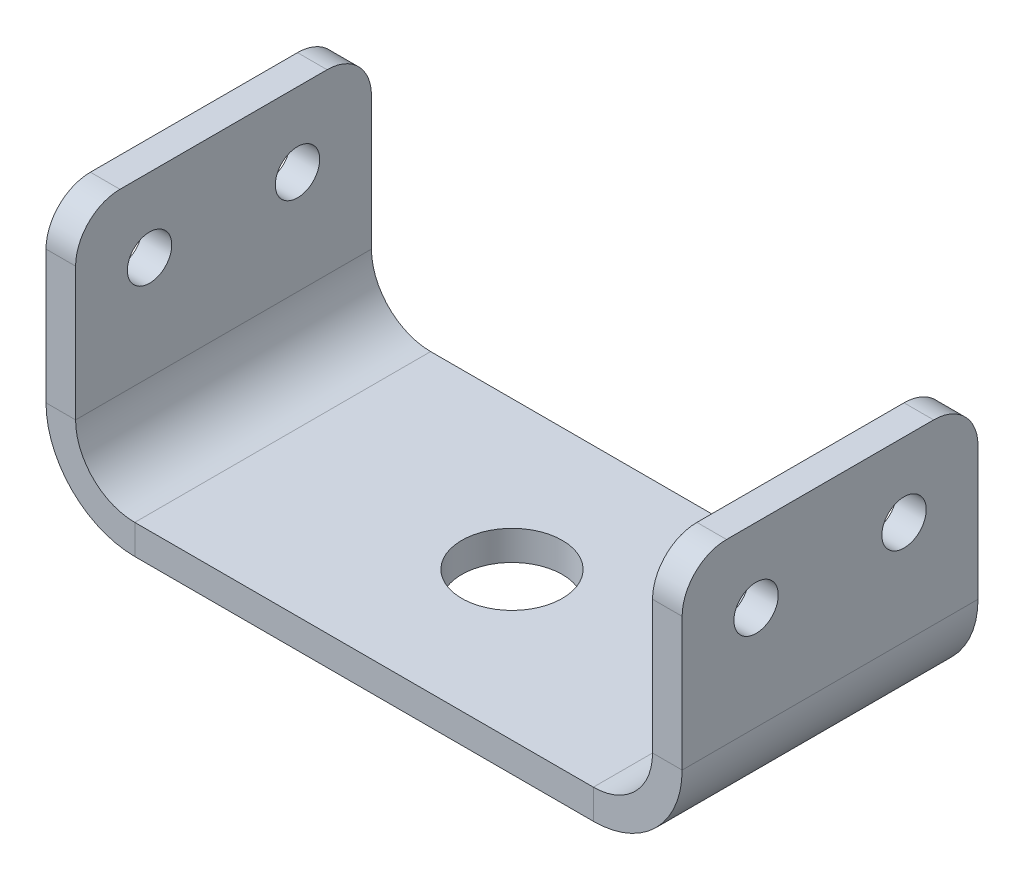
from build123d import *

# Parameters (mm, degrees)
SKETCH1_W            = 20
SKETCH1_H            = 6
BOSS_EXTRUDE1_DEPTH  = 21.5
SKETCH2_W            = 6
SKETCH2_H            = 20
BOSS_EXTRUDE2_DEPTH  = 12
SKETCH7_R            = 1.5
CUT_EXTRUDE1_DEPTH   = 46.749316935
SKETCH8_R            = 3.4
CUT_EXTRUDE2_DEPTH   = 30.769951293
FILLET2_R            = 3
CONVERT_SOLID2_START = -10
CONVERT_SOLID2_DEPTH = 20


# Read off the part's stored shape, not the designer's step: Convert-Solid2
with BuildPart() as part:
    # Sketch1 → Boss-Extrude1 (new, symmetric)
    with BuildSketch(Plane(origin=(0, 0, 0), x_dir=(0, 0, -1), z_dir=(1, 0, 0))):
        with Locations((0, -3)):
            Rectangle(SKETCH1_W, SKETCH1_H)
    extrude(amount=BOSS_EXTRUDE1_DEPTH, both=True)

    # Sketch2 → Boss-Extrude2 (add)
    with BuildSketch(Plane(origin=(0, 0, 0), x_dir=(1, 0, 0), z_dir=(0, 1, 0))):
        with Locations((18.5, 0)):
            Rectangle(SKETCH2_W, SKETCH2_H)
        with Locations((-18.5, 0)):
            Rectangle(SKETCH2_W, SKETCH2_H)
    extrude(amount=BOSS_EXTRUDE2_DEPTH)

    # Sketch7 → Cut-Extrude1 (cut, through all)
    with BuildSketch(Plane.ZY.offset(21.5)):
        with Locations((-5, 7)):
            Circle(SKETCH7_R)
        with Locations((5, 7)):
            Circle(SKETCH7_R)
    extrude(amount=-CUT_EXTRUDE1_DEPTH, mode=Mode.SUBTRACT)

    # Sketch8 → Cut-Extrude2 (cut, through all)
    with BuildSketch(Plane.XZ.offset(6)):
        with Locations(Location((0, 0, 0), (0, 0, 270))):
            Circle(SKETCH8_R)
    extrude(amount=-CUT_EXTRUDE2_DEPTH, mode=Mode.SUBTRACT)

    # Fillet2
    fillet2_edges = [part.edges().sort_by_distance(p)[0] for p in [
        (-18.5, 12, 10),
        (-18.5, 12, -10),
        (18.5, 12, -10),
        (18.5, 12, 10),
    ]]
    fillet(fillet2_edges, radius=FILLET2_R)

    # Convert-Solid2 outline → Convert-Solid2 (cut)
    with BuildSketch(Plane.XY.offset(CONVERT_SOLID2_START)):
        with BuildLine():
            Line((21.5, -6), (21.5, 0))
            ThreePointArc((21.5, 0), (19.742640687, -4.242640687), (15.5, -6))
            Line((15.5, -6), (21.5, -6))
        make_face()
        with BuildLine():
            Line((-21.5, -6), (-15.5, -6))
            ThreePointArc((-15.5, -6), (-19.742640687, -4.242640687), (-21.5, 0))
            Line((-21.5, 0), (-21.5, -6))
        make_face()
        with BuildLine():
            Line((19.5, 0), (19.5, 12))
            Line((19.5, 12), (15.5, 12))
            Line((15.5, 12), (15.5, 0))
            Line((15.5, 0), (-15.5, 0))
            Line((-15.5, 0), (-15.5, 12))
            Line((-15.5, 12), (-19.5, 12))
            Line((-19.5, 12), (-19.5, 0))
            ThreePointArc((-19.5, 0), (-18.328427125, -2.828427125), (-15.5, -4))
            Line((-15.5, -4), (15.5, -4))
            ThreePointArc((15.5, -4), (18.328427125, -2.828427125), (19.5, 0))
        make_face()
    extrude(amount=CONVERT_SOLID2_DEPTH, mode=Mode.SUBTRACT)


solid = part.part
